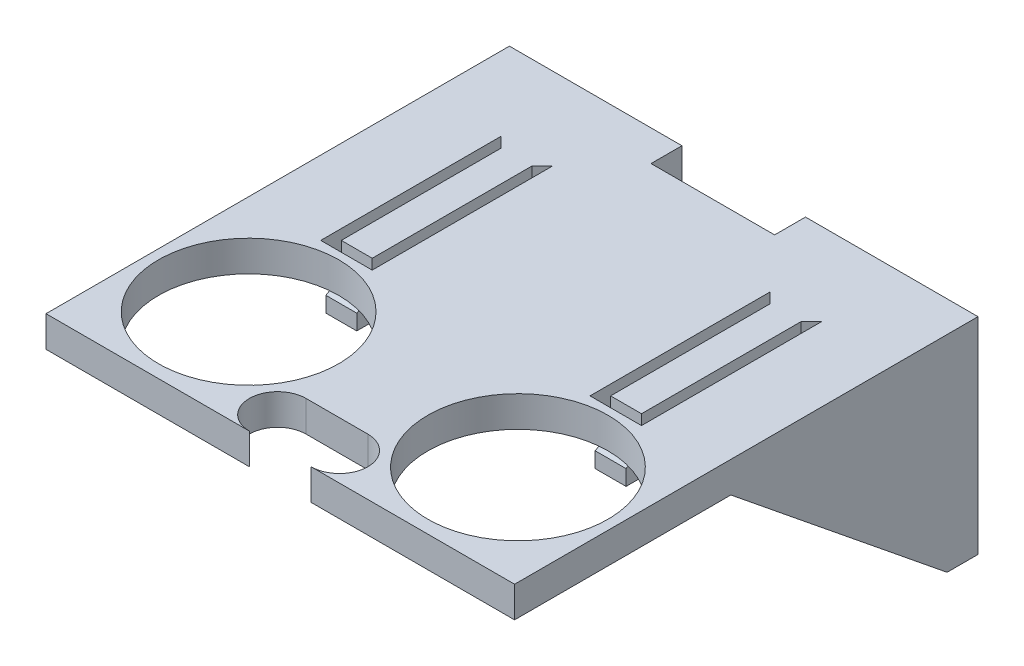
from build123d import *

# Parameters (mm, degrees)
SKETCH1_W               = 16.75
SKETCH1_H               = 20
BOSS_EXTRUDE1_DEPTH     = 3
BOSS_EXTRUDE1_2_DEPTH   = 3
SKETCH2_W               = 45.5
SKETCH2_H               = 3
BOSS_EXTRUDE2_DEPTH     = 42
SKETCH3_R               = 8.75
CUT_EXTRUDE1_DEPTH      = 61.44447165
BOSS_EXTRUDE3_DEPTH     = 2
LPATTERN1_COUNT         = 2
LPATTERN1_PITCH         = 43.5
CUT_EXTRUDE2_DEPTH      = 61.44447165
BOSS_EXTRUDE4_DEPTH     = 3
CUT_EXTRUDE3_DEPTH      = 61.44447165
SKETCH10_W              = 10
SKETCH10_H              = 2.5
CUT_EXTRUDE4_DEPTH      = 2
BOSS_EXTRUDE5_REACH     = 66.609
SKETCH13_W              = 3
SKETCH13_H              = 11.133974596
CUT_EXTRUDE6_DEPTH      = 1
CHAMFER1_SIZE           = 1
BOSS_EXTRUDE6_DEPTH     = 13.25
CHAMFER2_SIZE           = 1
ENL_V_MAT_EXTRU_1_REACH = 59.971
ESQUISSE1_R             = 2.3


with BuildPart() as part:
    # Sketch1 → Boss-Extrude1 (new body)
    with BuildSketch(Plane.XY):
        with Locations((-28.224646897, 6.034741944)):
            Rectangle(SKETCH1_W, SKETCH1_H)
    extrude(amount=BOSS_EXTRUDE1_DEPTH)


with BuildPart() as body_2:
    # Sketch1 → Boss-Extrude1 2 (new body)
    with BuildSketch(Plane.XY):
        with Locations((0.525353103, 6.034741944)):
            Rectangle(SKETCH1_W, SKETCH1_H)
    extrude(amount=BOSS_EXTRUDE1_2_DEPTH)



with BuildPart() as body_3:
    # Sketch2 → Boss-Extrude2 (new body)
    with BuildSketch(Plane.XY.offset(3)):
        with Locations((-13.849646897, 14.534741944)):
            Rectangle(SKETCH2_W, SKETCH2_H)
    extrude(amount=BOSS_EXTRUDE2_DEPTH)

    # Sketch3 → Cut-Extrude1 (cut, through all)
    with BuildSketch(Plane(origin=(0, 13.034741944, 0), x_dir=(-1, 0, 0), z_dir=(0, -1, 0))):
        with Locations(Location((26.924646897, -35, 0), (0, 0, 90))):
            Circle(SKETCH3_R)
        with Locations(Location((0.774646897, -35, 0), (0, 0, 90))):
            Circle(SKETCH3_R)
    extrude(amount=-CUT_EXTRUDE1_DEPTH, mode=Mode.SUBTRACT)


with BuildPart() as body_2_1:
    add(body_2.part)

    add(body_3.part)  # Boss-Extrude3 merges body 3
    # Sketch4 → Boss-Extrude3 (add)
    with BuildSketch(Plane(origin=(8.900353103, 0, 0), x_dir=(0, 0, -1), z_dir=(1, 0, 0))):
        Polygon((-3, -3.965258056), (-24, 13.034741944), (-3, 13.034741944), align=None)
    boss_extrude3 = extrude(amount=-BOSS_EXTRUDE3_DEPTH)


with BuildPart() as part_1:
    add(part.part)

    add(body_2_1.part)  # LPattern1 merges body 2
    # LPattern1: Boss-Extrude3 ×2
    with Locations(*[(-i * LPATTERN1_PITCH, 0, 0) for i in range(1, LPATTERN1_COUNT)]):
        add(boss_extrude3)

    # Sketch5 → Cut-Extrude2 (cut, through all)
    with BuildSketch(Plane(origin=(0, 13.034741944, 0), x_dir=(-1, 0, 0), z_dir=(0, -1, 0))):
        Polygon((29.424646897, -8), (29.424646897, -25.5), (24.424646897, -25.5), (24.424646897, -8), (25.424646897, -8), (25.424646897, -24.5), (28.424646897, -24.5), (28.424646897, -8), align=None)
        Polygon((-0.725353103, -8), (-1.725353103, -8), (-1.725353103, -25.5), (3.274646897, -25.5), (3.274646897, -8), (2.274646897, -8), (2.274646897, -24.5), (-0.725353103, -24.5), align=None)
    extrude(amount=-CUT_EXTRUDE2_DEPTH, mode=Mode.SUBTRACT)

    # Sketch6 → Boss-Extrude4 (add)
    with BuildSketch(Plane(origin=(-25.424646897, 0, 0), x_dir=(0, 0, -1), z_dir=(1, 0, 0))):
        Polygon((-24.5, 13.034741944), (-26, 12.16871654), (-26, 10.66871654), (-21.5, 10.66871654), (-19.133974596, 13.034741944), align=None)
    boss_extrude4 = extrude(amount=-BOSS_EXTRUDE4_DEPTH)

    # Mirror7: Boss-Extrude4 across plane
    add(boss_extrude4.mirror(Plane(origin=(-13.849646897, 13.034741944, 8), x_dir=(0, 0, 1), z_dir=(1, 0, 0))))

    # Sketch9 → Cut-Extrude3 (cut, through all)
    with BuildSketch(Plane(origin=(0, 13.034741944, 0), x_dir=(-1, 0, 0), z_dir=(0, -1, 0))):
        with BuildLine():
            Line((16.849646897, -45), (10.849646897, -45))
            ThreePointArc((10.849646897, -45), (8.099646897, -42.25), (10.849646897, -39.5))
            Line((10.849646897, -39.5), (16.849646897, -39.5))
            ThreePointArc((16.849646897, -39.5), (19.599646897, -42.25), (16.849646897, -45))
        make_face()
    extrude(amount=-CUT_EXTRUDE3_DEPTH, mode=Mode.SUBTRACT)

    # Sketch10 → Cut-Extrude4 (cut)
    with BuildSketch(Plane(origin=(0, 13.034741944, 0), x_dir=(-1, 0, 0), z_dir=(0, -1, 0))):
        with Locations((13.849646897, -26.25)):
            Rectangle(SKETCH10_W, SKETCH10_H)
    extrude(amount=-CUT_EXTRUDE4_DEPTH, mode=Mode.SUBTRACT)

    # Boss-Extrude5: up to this face of the body (flat: up to its plane)
    boss_extrude5_end = Plane(part_1.part.faces().sort_by_distance((6.900353103, 7.368075277, 10))[0])
    # Sketch11 → Boss-Extrude5 (add, up to the picked face)
    with BuildSketch(Plane(origin=(-34.599646897, 0, 0), x_dir=(0, 0, -1), z_dir=(1, 0, 0)), mode=Mode.PRIVATE) as boss_extrude5_sk1:
        Polygon((-5.617808219, -1.846079974), (-3, -3.965258056), (-3, -0.465258056), (-4.5, -0.465258056), align=None)
    boss_extrude5_tool1 = split(extrude(boss_extrude5_sk1.sketch, amount=BOSS_EXTRUDE5_REACH, mode=Mode.PRIVATE), bisect_by=boss_extrude5_end, keep=Keep.BOTH, mode=Mode.PRIVATE)
    add(boss_extrude5_tool1.solids().sort_by(Axis((-34.599647, -1.87709, 3.964792), (1, 0, 0)))[0])

    # Sketch13 → Cut-Extrude6 (cut)
    with BuildSketch(Plane(origin=(0, 13.034741944, 0), x_dir=(-1, 0, 0), z_dir=(0, -1, 0))):
        with Locations((26.924646897, -13.566987298)):
            Rectangle(SKETCH13_W, SKETCH13_H)
        with Locations((0.774646897, -13.566987298)):
            Rectangle(SKETCH13_W, SKETCH13_H)
    extrude(amount=-CUT_EXTRUDE6_DEPTH, mode=Mode.SUBTRACT)

    # Chamfer1
    chamfer1_edges = [part_1.edges().sort_by_distance(p)[0] for p in [
        (-26.924646897, 14.034741944, 8),
        (-0.774646897, 14.034741944, 8),
    ]]
    chamfer(chamfer1_edges, length=CHAMFER1_SIZE - 0.0001)  # a hair under: the kernel refuses the full size

    # Sketch11<3> → Boss-Extrude6 (add)
    with BuildSketch(Plane(origin=(-34.599646897, 0, 0), x_dir=(0, 0, -1), z_dir=(1, 0, 0))):
        Polygon((-4.5, -0.465258056), (-3, -0.465258056), (-3, 1.38768312), align=None)
    boss_extrude6 = extrude(amount=BOSS_EXTRUDE6_DEPTH)

    # Mirror8: Boss-Extrude6 across plane
    add(boss_extrude6.mirror(Plane(origin=(-13.849646897, 13.034741944, 8), x_dir=(0, 0, 1), z_dir=(1, 0, 0))))

    # Chamfer2
    chamfer2_edges = [part_1.edges().sort_by_distance(p)[0] for p in [
        (-28.424646897, 14.534791944, 8),
        (-2.274646897, 14.534791944, 8),
        (-25.424646897, 14.534791944, 8),
        (0.725353103, 14.534791944, 8),
    ]]
    chamfer(chamfer2_edges, length=CHAMFER2_SIZE - 0.0001)  # a hair under: the kernel refuses the full size

    # Esquisse1 → Enlèv. mat.-Extru.1 (cut, up to next)
    with BuildSketch(Plane.XY.offset(3), mode=Mode.PRIVATE) as enl_v_mat_extru_1_sk1:
        with Locations((-3.849646897, 6.284741944)):
            Circle(ESQUISSE1_R)
    enl_v_mat_extru_1_tool1 = extrude(enl_v_mat_extru_1_sk1.sketch, amount=-ENL_V_MAT_EXTRU_1_REACH, mode=Mode.PRIVATE) & part_1.part
    # Esquisse1 → Enlèv. mat.-Extru.1 (cut, up to next)
    with BuildSketch(Plane.XY.offset(3), mode=Mode.PRIVATE) as enl_v_mat_extru_1_sk2:
        with Locations((-23.849646897, 6.284741944)):
            Circle(ESQUISSE1_R)
    enl_v_mat_extru_1_tool2 = extrude(enl_v_mat_extru_1_sk2.sketch, amount=-ENL_V_MAT_EXTRU_1_REACH, mode=Mode.PRIVATE) & part_1.part
    add(enl_v_mat_extru_1_tool1.solids().sort_by_distance((-3.849647, 6.284742, 3))[0], mode=Mode.SUBTRACT)
    add(enl_v_mat_extru_1_tool2.solids().sort_by_distance((-23.849647, 6.284742, 3))[0], mode=Mode.SUBTRACT)


solid = part_1.part
